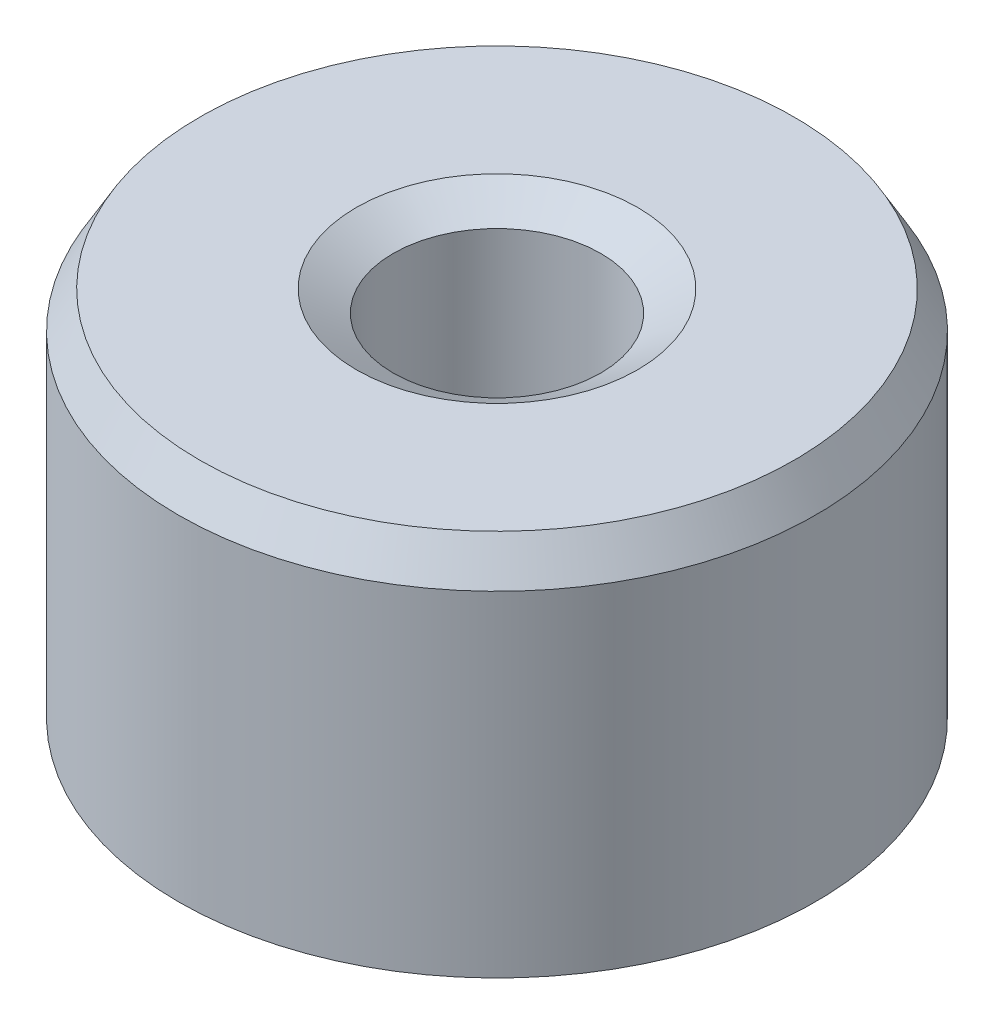
from build123d import *
from OCP.BRepFilletAPI import BRepFilletAPI_MakeChamfer

# Parameters (mm, degrees)
SKETCH1_R           = 5
BOSS_EXTRUDE1_DEPTH = 6.170558188
SKETCH2_R           = 1.62817612
CUT_EXTRUDE1_DEPTH  = 10.384870183
CHAMFER1_SIZE       = 0.579446109
CHAMFER1_SIZE2      = 0.334543367


with BuildPart() as part:
    # Sketch1 → Boss-Extrude1 (new body)
    with BuildSketch(Plane(origin=(0, 0, 0), x_dir=(1, 0, 0), z_dir=(0, 1, 0))):
        Circle(SKETCH1_R)
    extrude(amount=BOSS_EXTRUDE1_DEPTH)

    # Sketch2 → Cut-Extrude1 (cut, through all)
    with BuildSketch(Plane(origin=(0, 0, 0), x_dir=(1, 0, 0), z_dir=(0, 1, 0))):
        Circle(SKETCH2_R)
    extrude(amount=CUT_EXTRUDE1_DEPTH, mode=Mode.SUBTRACT)

    # Chamfer1: one chamfer whose edges measure the first distance from different faces: ONE call of the kernel's chamfer builder (chamfer() names one face for all edges)
    chamfer1_edges_1 = [part.edges().sort_by_distance(p)[0] for p in [
        (-1.62817612, 6.170558188, 0),
    ]]
    chamfer1_side_1 = [part.faces().sort_by_distance(p)[0] for p in [
        (-4.858578644, 6.170558188, 0),
    ]]
    chamfer1_edges_2 = [part.edges().sort_by_distance(p)[0] for p in [
        (-1.62817612, 0, 0),
    ]]
    chamfer1_side_2 = [part.faces().sort_by_distance(p)[0] for p in [
        (-1.62817612, 3.085279094, 0),
    ]]
    chamfer1_edges_3 = [part.edges().sort_by_distance(p)[0] for p in [
        (-5, 0, 0),
    ]]
    chamfer1_side_3 = [part.faces().sort_by_distance(p)[0] for p in [
        (-4.858578644, 0, 0),
    ]]
    chamfer1_edges_4 = [part.edges().sort_by_distance(p)[0] for p in [
        (-5, 6.170558188, 0),
    ]]
    chamfer1_side_4 = [part.faces().sort_by_distance(p)[0] for p in [
        (-5, 3.085279094, 0),
    ]]
    chamfer1 = BRepFilletAPI_MakeChamfer(part.part.solid().wrapped)
    for e in chamfer1_edges_1:
        chamfer1.Add(CHAMFER1_SIZE, CHAMFER1_SIZE2, e.wrapped, chamfer1_side_1[0].wrapped)  # the first distance lies on this face
    for e in chamfer1_edges_2:
        chamfer1.Add(CHAMFER1_SIZE, CHAMFER1_SIZE2, e.wrapped, chamfer1_side_2[0].wrapped)  # the first distance lies on this face
    for e in chamfer1_edges_3:
        chamfer1.Add(CHAMFER1_SIZE, CHAMFER1_SIZE2, e.wrapped, chamfer1_side_3[0].wrapped)  # the first distance lies on this face
    for e in chamfer1_edges_4:
        chamfer1.Add(CHAMFER1_SIZE, CHAMFER1_SIZE2, e.wrapped, chamfer1_side_4[0].wrapped)  # the first distance lies on this face
    add(Compound.cast(chamfer1.Shape()), mode=Mode.REPLACE)


solid = part.part
